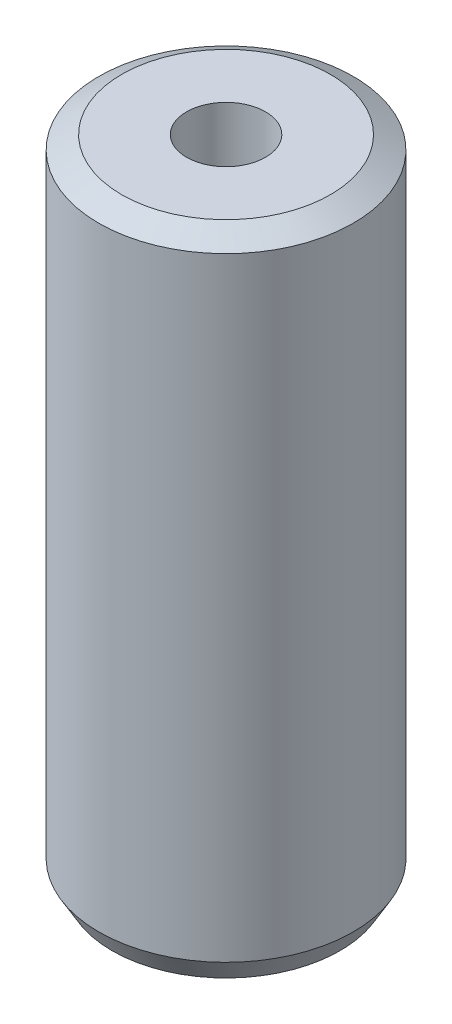
from build123d import *
from OCP.BRepFilletAPI import BRepFilletAPI_MakeChamfer

# Parameters (mm, degrees)
SKETCH1_R           = 17.5
BOSS_EXTRUDE1_DEPTH = 89.392533874
SKETCH2_R           = 5.427398936
CUT_EXTRUDE1_DEPTH  = 93.75518914
CHAMFER1_SIZE       = 1.82027392
CHAMFER1_SIZE2      = 3.152806914


with BuildPart() as part:
    # Sketch1 → Boss-Extrude1 (new body)
    with BuildSketch(Plane(origin=(0, 0, 0), x_dir=(1, 0, 0), z_dir=(0, 1, 0))):
        Circle(SKETCH1_R)
    extrude(amount=BOSS_EXTRUDE1_DEPTH)

    # Sketch2 → Cut-Extrude1 (cut, through all)
    with BuildSketch(Plane(origin=(0, 0, 0), x_dir=(1, 0, 0), z_dir=(0, 1, 0))):
        Circle(SKETCH2_R)
    extrude(amount=CUT_EXTRUDE1_DEPTH, mode=Mode.SUBTRACT)

    # Chamfer1: one chamfer whose edges measure the first distance from different faces: ONE call of the kernel's chamfer builder (chamfer() names one face for all edges)
    chamfer1_edges_1 = [part.edges().sort_by_distance(p)[0] for p in [
        (-17.5, 89.392533874, 0),
    ]]
    chamfer1_side_1 = [part.faces().sort_by_distance(p)[0] for p in [
        (-17.5, 44.696266937, 0),
    ]]
    chamfer1_edges_2 = [part.edges().sort_by_distance(p)[0] for p in [
        (-17.5, 0, 0),
    ]]
    chamfer1_side_2 = [part.faces().sort_by_distance(p)[0] for p in [
        (-17.005025253, 0, 0),
    ]]
    chamfer1 = BRepFilletAPI_MakeChamfer(part.part.solid().wrapped)
    for e in chamfer1_edges_1:
        chamfer1.Add(CHAMFER1_SIZE, CHAMFER1_SIZE2, e.wrapped, chamfer1_side_1[0].wrapped)  # the first distance lies on this face
    for e in chamfer1_edges_2:
        chamfer1.Add(CHAMFER1_SIZE, CHAMFER1_SIZE2, e.wrapped, chamfer1_side_2[0].wrapped)  # the first distance lies on this face
    add(Compound.cast(chamfer1.Shape()), mode=Mode.REPLACE)


solid = part.part
